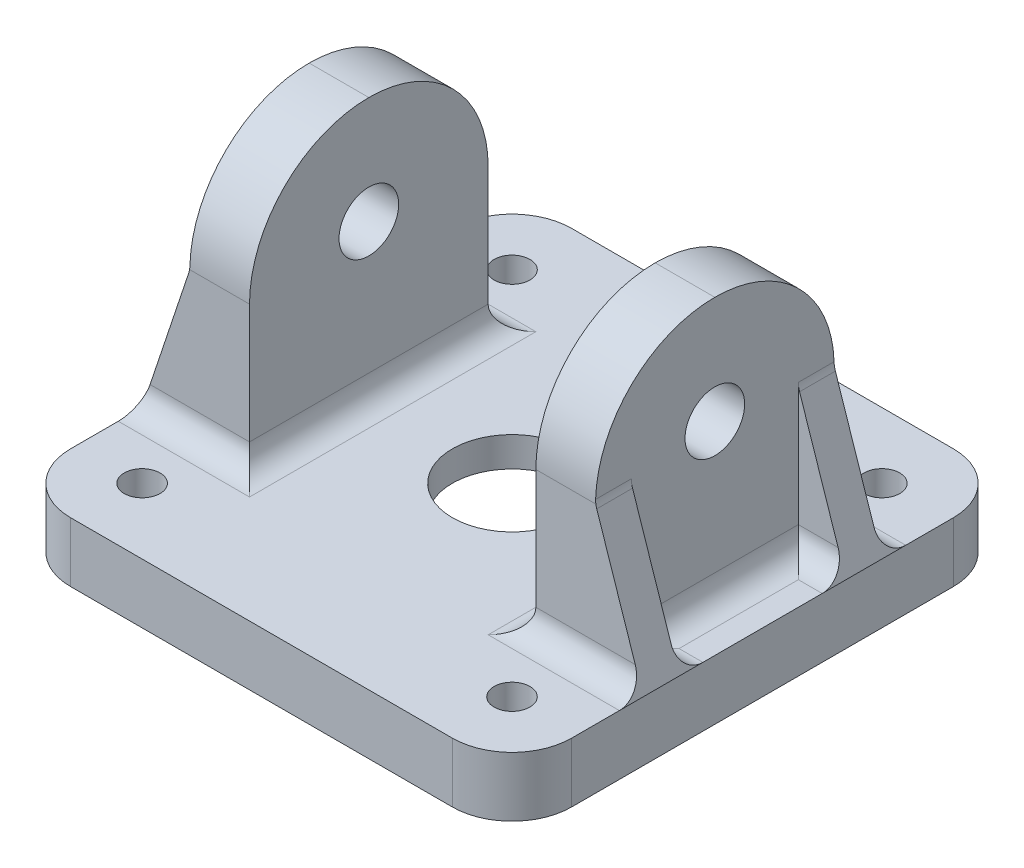
from build123d import *

# Parameters (mm, degrees)
SKETCH1_W               = 42
SKETCH1_H               = 42
SKETCH1_R               = 1.5
BOSS_EXTRUDE1_DEPTH     = 5
SKETCH2_W               = 5
SKETCH2_H               = 20
BOSS_EXTRUDE2_DEPTH     = 27
CUT_EXTRUDE1_DEPTH      = 41.137264481
CUT_EXTRUDE1_DEPTH_BACK = 41.137264481
SKETCH3_R               = 2.5
FILLET1_R               = 10
FILLET2_R               = 5
SKETCH4_R               = 11.25
CUT_EXTRUDE2_DEPTH      = 2.5
SKETCH5_R               = 5
CUT_EXTRUDE3_DEPTH      = 10
SKETCH6_W               = 4
SKETCH6_H               = 3
BOSS_EXTRUDE3_DEPTH     = 17
CUT_EXTRUDE4_DEPTH      = 41.137264481
CUT_EXTRUDE4_DEPTH_BACK = 41.137264481
FILLET3_R               = 2


with BuildPart() as part:
    # Sketch1 → Boss-Extrude1 (new body)
    with BuildSketch(Plane(origin=(0, 0, 0), x_dir=(1, 0, 0), z_dir=(0, 1, 0))):
        Rectangle(SKETCH1_W, SKETCH1_H)
        with Locations(Location((-15.5, 15.5, 0), (0, 0, 270))):
            Circle(SKETCH1_R, mode=Mode.SUBTRACT)
        with Locations(Location((15.5, 15.5, 0), (0, 0, 270))):
            Circle(SKETCH1_R, mode=Mode.SUBTRACT)
        with Locations(Location((15.5, -15.5, 0), (0, 0, 270))):
            Circle(SKETCH1_R, mode=Mode.SUBTRACT)
        with Locations(Location((-15.5, -15.5, 0), (0, 0, 270))):
            Circle(SKETCH1_R, mode=Mode.SUBTRACT)
    extrude(amount=BOSS_EXTRUDE1_DEPTH)

    # Sketch2 → Boss-Extrude2 (add)
    with BuildSketch(Plane(origin=(0, 0, 0), x_dir=(1, 0, 0), z_dir=(0, 1, 0))):
        with Locations((-14.5, 0)):
            Rectangle(SKETCH2_W, SKETCH2_H)
        with Locations((14.5, 0)):
            Rectangle(SKETCH2_W, SKETCH2_H)
    extrude(amount=BOSS_EXTRUDE2_DEPTH)

    # Sketch3 → Cut-Extrude1 (cut, two sides: drawn at the far end of the back side and taken through both)
    with BuildSketch(Plane(origin=(0, 0, 0), x_dir=(0, 0, -1), z_dir=(1, 0, 0)).offset(-CUT_EXTRUDE1_DEPTH_BACK)):
        with Locations((0, 18)):
            Circle(SKETCH3_R)
    extrude(amount=CUT_EXTRUDE1_DEPTH + CUT_EXTRUDE1_DEPTH_BACK, mode=Mode.SUBTRACT)

    # Fillet1
    fillet1_edges = [part.edges().sort_by_distance(p)[0] for p in [
        (-14.5, 27, 10),
        (-14.5, 27, -10),
        (14.5, 27, -10),
        (14.5, 27, 10),
    ]]
    fillet(fillet1_edges, radius=FILLET1_R - 0.0001)  # a hair under: the kernel refuses the full size

    # Fillet2
    fillet2_edges = [part.edges().sort_by_distance(p)[0] for p in [
        (21, 2.5, 21),
        (-21, 2.5, 21),
        (-21, 2.5, -21),
        (21, 2.5, -21),
    ]]
    fillet(fillet2_edges, radius=FILLET2_R)

    # Sketch4 → Cut-Extrude2 (cut)
    with BuildSketch(Plane(origin=(0, 0, 0), x_dir=(1, 0, 0), z_dir=(0, 1, 0))):
        with Locations(Location((0, 0, 0), (0, 0, 270))):
            Circle(SKETCH4_R)
    extrude(amount=CUT_EXTRUDE2_DEPTH, mode=Mode.SUBTRACT)

    # Sketch5 → Cut-Extrude3 (cut)
    with BuildSketch(Plane(origin=(0, 0, 0), x_dir=(1, 0, 0), z_dir=(0, 1, 0))):
        with Locations(Location((0, 0, 0), (0, 0, 270))):
            Circle(SKETCH5_R)
    extrude(amount=CUT_EXTRUDE3_DEPTH, mode=Mode.SUBTRACT)

    # Sketch6 → Boss-Extrude3 (add)
    with BuildSketch(Plane(origin=(0, 0, 0), x_dir=(1, 0, 0), z_dir=(0, 1, 0))):
        with Locations((-19, 8.5)):
            Rectangle(SKETCH6_W, SKETCH6_H)
        with Locations((-19, -8.5)):
            Rectangle(SKETCH6_W, SKETCH6_H)
        with Locations((19, -8.5)):
            Rectangle(SKETCH6_W, SKETCH6_H)
        with Locations((19, 8.5)):
            Rectangle(SKETCH6_W, SKETCH6_H)
    extrude(amount=BOSS_EXTRUDE3_DEPTH)

    # Sketch7 → Cut-Extrude4 (cut, two sides: drawn at the far end of the back side and taken through both)
    with BuildSketch(Plane.XY.offset(-CUT_EXTRUDE4_DEPTH_BACK)):
        Polygon((-17, 17), (-21, 5), (-21, 17), align=None)
        Polygon((17, 17), (21, 17), (21, 5), align=None)
    extrude(amount=CUT_EXTRUDE4_DEPTH + CUT_EXTRUDE4_DEPTH_BACK, mode=Mode.SUBTRACT)

    # Fillet3
    fillet3_edges = [part.edges().sort_by_distance(p)[0] for p in [
        (-19, 5, -7),
        (-17, 17, -8.5),
        (-17, 5, 0),
        (-19, 5, 7),
        (-17, 17, 8.5),
        (19, 5, 7),
        (17, 17, 8.5),
        (17, 5, 0),
        (19, 5, -7),
        (17, 17, -8.5),
        (-16.5, 5, 10),
        (-12, 5, 0),
        (-16.5, 5, -10),
        (16.5, 5, -10),
        (12, 5, 0),
        (16.5, 5, 10),
    ]]
    fillet(fillet3_edges, radius=FILLET3_R)


solid = part.part
